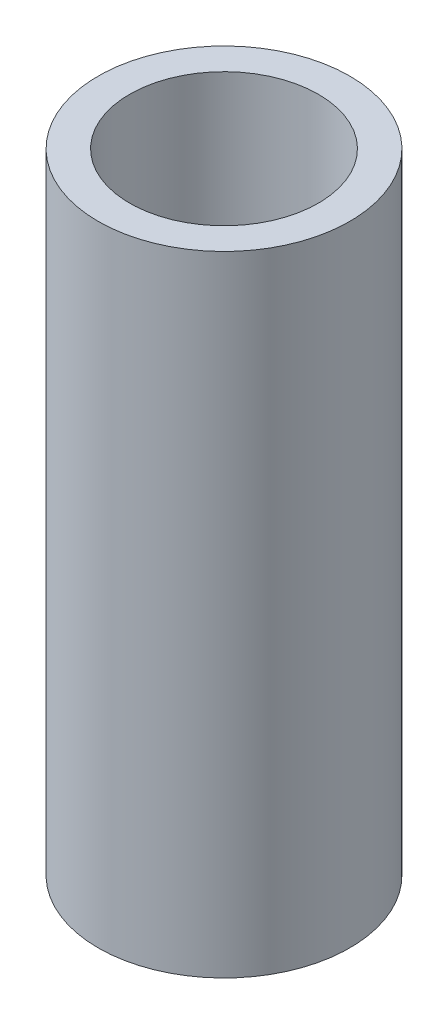
from build123d import *

# Parameters (mm, degrees)
SKETCH_1_R      = 20
SKETCH_1_R_2    = 15
EXTRUDE_1_DEPTH = 100


with BuildPart() as part:
    # Эскиз1 → Вытянуть-Тонкостенный1 (new body)
    with BuildSketch(Plane(origin=(0, 0, 0), x_dir=(1, 0, 0), z_dir=(0, 1, 0))):
        Circle(SKETCH_1_R)
        Circle(SKETCH_1_R_2, mode=Mode.SUBTRACT)
    extrude(amount=EXTRUDE_1_DEPTH)


solid = part.part
